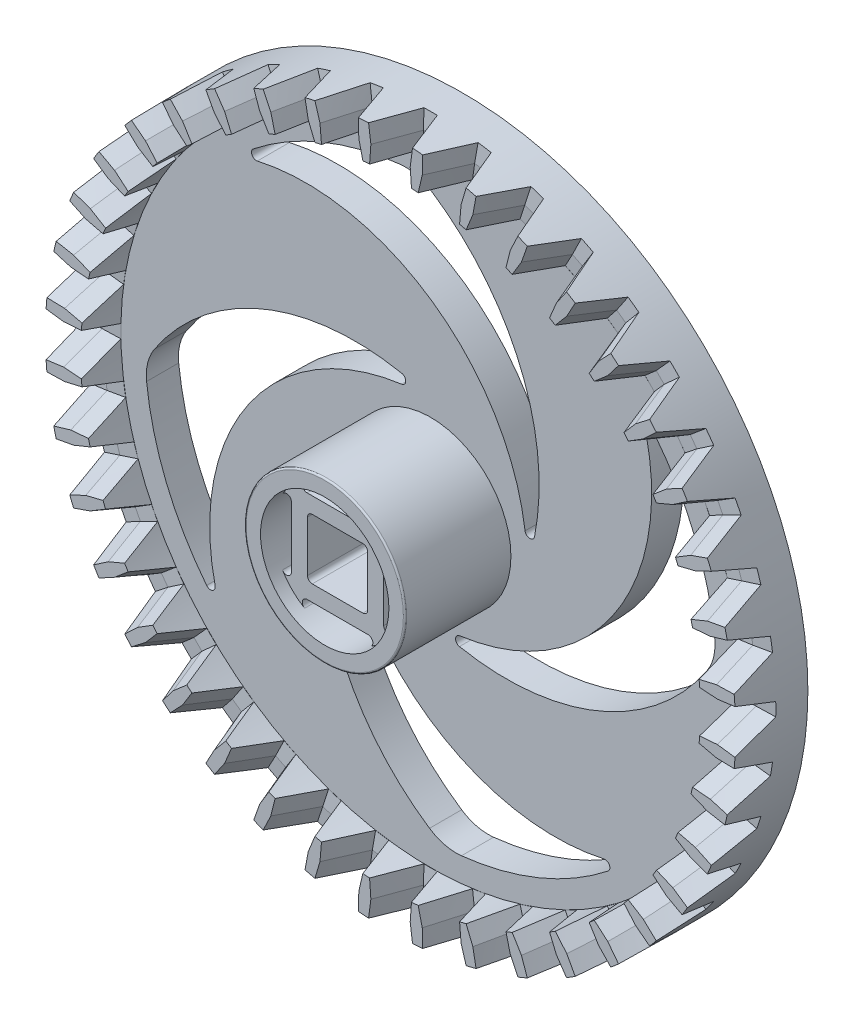
from build123d import *

# Parameters (mm, degrees)
SKETCH1_R               = 21.5
BOSS_EXTRUDE1_DEPTH     = 3.4
CUT_EXTRUDE2_DEPTH      = 31.595097647
CUT_EXTRUDE2_DEPTH_BACK = 31.595097647
SKETCH2_W               = 3.75
SKETCH2_H               = 3.75
SKETCH4_R               = 21.5
SKETCH4_R_2             = 19.3
BOSS_EXTRUDE2_DEPTH     = 2.5
CIRPATTERN1_COUNT       = 40
SKETCH9_R               = 5
SKETCH9_W               = 3.75
SKETCH9_H               = 3.75
BOSS_EXTRUDE3_DEPTH     = 6.6
SKETCH10_R              = 21.5
CUT_EXTRUDE3_DEPTH      = 1.4
BOSS_EXTRUDE4_START     = 1.4
SKETCH11_R              = 5
SKETCH11_R_2            = 4
BOSS_EXTRUDE4_DEPTH     = 1.4
SKETCH12_W              = 5.75
SKETCH12_H              = 5.75
SKETCH12_W_2            = 3.75
SKETCH12_H_2            = 3.75
BOSS_EXTRUDE5_DEPTH     = 0.6
CUT_EXTRUDE4_START      = -6.6
CUT_EXTRUDE4_DEPTH      = 6.6
CUT_EXTRUDE5_START      = -0.8
SKETCH14_R              = 4
CUT_EXTRUDE5_DEPTH      = 0.8
FILLET1_R               = 0.3
FILLET2_R               = 0.1
CUT_EXTRUDE6_DEPTH      = 10
CIRPATTERN2_COUNT       = 4
FILLET3_R               = 0.3
FILLET4_R               = 3


with BuildPart() as part:
    # Sketch1 → Boss-Extrude1 (new body)
    with BuildSketch(Plane.XY):
        Circle(SKETCH1_R)
    extrude(amount=BOSS_EXTRUDE1_DEPTH)

    # Sketch2 → Cut-Extrude2 (cut, two sides: drawn at the far end of the back side and taken through both)
    with BuildSketch(Plane.XY.offset(-CUT_EXTRUDE2_DEPTH_BACK)):
        Rectangle(SKETCH2_W, SKETCH2_H)
    extrude(amount=CUT_EXTRUDE2_DEPTH + CUT_EXTRUDE2_DEPTH_BACK, mode=Mode.SUBTRACT)

    # Sketch4 → Boss-Extrude2 (add)
    with BuildSketch(Plane.XY.offset(3.4)):
        Circle(SKETCH4_R)
        Circle(SKETCH4_R_2, mode=Mode.SUBTRACT)
    extrude(amount=BOSS_EXTRUDE2_DEPTH)

    # Sketch6 → Cut-Loft2 section 0
    with BuildSketch(Plane(origin=(0, 19.255829637, 0), x_dir=(1, 0, 0), z_dir=(0, 1, 0))):
        with BuildLine():
            Line((-1.305, -5.9), (1.305, -5.9))
            Line((1.305, -5.9), (0.415, -3.4))
            Line((0.415, -3.4), (-0.415, -3.4))
            Line((-0.415, -3.4), (-1.305, -5.9))
        make_face()
    # Sketch7 → Cut-Loft2 section 1
    with BuildSketch(Plane(origin=(0, 20.363186759, 0), x_dir=(1, 0, 0), z_dir=(0, 1, 0))):
        with BuildLine():
            Line((-1.225, -5.9), (1.225, -5.9))
            Line((1.225, -5.9), (0.35, -3.5))
            Line((0.35, -3.5), (-0.35, -3.5))
            Line((-0.35, -3.5), (-1.225, -5.9))
        make_face()
    cut_loft2 = loft(mode=Mode.SUBTRACT)

    # Sketch7<2> → Cut-Loft4 section 0
    with BuildSketch(Plane(origin=(0, 20.363186759, 0), x_dir=(1, 0, 0), z_dir=(0, 1, 0))):
        with BuildLine():
            Line((-1.225, -5.9), (1.225, -5.9))
            Line((1.225, -5.9), (0.35, -3.5))
            Line((0.35, -3.5), (-0.35, -3.5))
            Line((-0.35, -3.5), (-1.225, -5.9))
        make_face()
    # Sketch8 → Cut-Loft4 section 1
    with BuildSketch(Plane(origin=(0, 21.5, 0), x_dir=(1, 0, 0), z_dir=(0, 1, 0))):
        with BuildLine():
            Line((-1.375, -5.9), (1.375, -5.9))
            Line((1.375, -5.9), (0.415, -3.4))
            Line((0.415, -3.4), (-0.415, -3.4))
            Line((-0.415, -3.4), (-1.375, -5.9))
        make_face()
    cut_loft4 = loft(mode=Mode.SUBTRACT)

    # CirPattern1: Cut-Loft2, Cut-Loft4 ×40 about axis
    cirpattern1_axis = Axis((0, 0, 0), (0, 0, 1))
    add([cut_loft2.rotate(cirpattern1_axis, i * 360 / CIRPATTERN1_COUNT) for i in range(1, CIRPATTERN1_COUNT)], mode=Mode.SUBTRACT)
    add([cut_loft4.rotate(cirpattern1_axis, i * 360 / CIRPATTERN1_COUNT) for i in range(1, CIRPATTERN1_COUNT)], mode=Mode.SUBTRACT)

    # Sketch9 → Boss-Extrude3 (add)
    with BuildSketch(Plane.XY.offset(3.4)):
        Circle(SKETCH9_R)
        Rectangle(SKETCH9_W, SKETCH9_H, mode=Mode.SUBTRACT)
    extrude(amount=BOSS_EXTRUDE3_DEPTH)

    # Sketch10 → Cut-Extrude3 (cut)
    with BuildSketch(Plane(origin=(0, 0, 0), x_dir=(-1, 0, 0), z_dir=(0, 0, -1))):
        with Locations(Location((0, 0, 0), (0, 0, 1.10540069))):
            Circle(SKETCH10_R)
    extrude(amount=-CUT_EXTRUDE3_DEPTH, mode=Mode.SUBTRACT)

    # Sketch11 → Boss-Extrude4 (add)
    with BuildSketch(Plane(origin=(0, 0, 1.4), x_dir=(-1, 0, 0), z_dir=(0, 0, -1)).offset(BOSS_EXTRUDE4_START)):
        with Locations(Location((0, 0, 0), (0, 0, 180))):
            Circle(SKETCH11_R)
        with Locations(Location((0, 0, 0), (0, 0, 180))):
            Circle(SKETCH11_R_2, mode=Mode.SUBTRACT)
    extrude(amount=-BOSS_EXTRUDE4_DEPTH)

    # Sketch12 → Boss-Extrude5 (add)
    with BuildSketch(Plane(origin=(0, 0, 1.4), x_dir=(-1, 0, 0), z_dir=(0, 0, -1))):
        Rectangle(SKETCH12_W, SKETCH12_H)
        Rectangle(SKETCH12_W_2, SKETCH12_H_2, mode=Mode.SUBTRACT)
    extrude(amount=BOSS_EXTRUDE5_DEPTH)

    # Sketch13 → Cut-Extrude4 (cut)
    with BuildSketch(Plane.XY.offset(10).offset(CUT_EXTRUDE4_START)):
        with BuildLine():
            Line((-2.781074433, 2.875), (2.781074433, 2.875))
            ThreePointArc((2.781074433, 2.875), (0, 4), (-2.781074433, 2.875))
        make_face()
        with BuildLine():
            Line((-2.875, -2.781074433), (-2.875, 2.781074433))
            ThreePointArc((-2.875, 2.781074433), (-4, 0), (-2.875, -2.781074433))
        make_face()
        with BuildLine():
            ThreePointArc((4, 0), (3.708099244, 1.5), (2.875, 2.781074433))
            Line((2.875, 2.781074433), (2.875, -2.781074433))
            ThreePointArc((2.875, -2.781074433), (3.708099244, -1.5), (4, 0))
        make_face()
        with BuildLine():
            ThreePointArc((-2.781074433, -2.875), (0, -4), (2.781074433, -2.875))
            Line((2.781074433, -2.875), (-2.781074433, -2.875))
        make_face()
    extrude(amount=CUT_EXTRUDE4_DEPTH, mode=Mode.SUBTRACT)

    # Sketch14 → Cut-Extrude5 (cut)
    with BuildSketch(Plane.XY.offset(10).offset(CUT_EXTRUDE5_START)):
        Circle(SKETCH14_R)
    extrude(amount=CUT_EXTRUDE5_DEPTH, mode=Mode.SUBTRACT)

    # Fillet1
    # the kernel refuses this fillet: 0.3 mm, written as the material it adds along each edge
    with BuildSketch(Plane(origin=(1.875, 1.875, 0.8), x_dir=(-1, 0, 0), z_dir=(0, 0, 1)), Plane(origin=(-1.875, 1.875, 0.8), x_dir=(0, -1, 0), z_dir=(0, 0, 1))) as fillet1_piece_1:
        with BuildLine():
            CenterArc((FILLET1_R, FILLET1_R), FILLET1_R, 180, 90)
            Line((0, FILLET1_R), (0, 0))
            Line((0, 0), (FILLET1_R, 0))
        make_face()
    extrude(amount=8.4)
    with BuildSketch(Plane(origin=(-1.875, -1.875, 0.8), x_dir=(0, 1, 0), z_dir=(0, 0, 1)), Plane(origin=(1.875, -1.875, 9.2), x_dir=(0, 1, 0), z_dir=(0, 0, -1))) as fillet1_piece_2:
        with BuildLine():
            CenterArc((FILLET1_R, -FILLET1_R), FILLET1_R, 90, 90)
            Line((0, -FILLET1_R), (0, 0))
            Line((0, 0), (FILLET1_R, 0))
        make_face()
    extrude(amount=8.4)
    with BuildSketch(Plane(origin=(2.781074433, -2.875, 3.69067148), x_dir=(-1, 0, 0), z_dir=(0, 0, -1)), Plane(origin=(-2.875, -2.781074433, 3.69067148), x_dir=(0, 1, 0), z_dir=(0, 0, -1)), Plane(origin=(-2.781074433, 2.875, 3.69067148), x_dir=(1, 0, 0), z_dir=(0, 0, -1)), Plane(origin=(2.875, 2.781074433, 3.69067148), x_dir=(0, -1, 0), z_dir=(0, 0, -1))) as fillet1_piece_3:
        with BuildLine():
            CenterArc((0.881238913, -0.3), FILLET1_R, 90, 149.104820427)
            ThreePointArc((0.727198196, -0.557432432), (0.347585225, -0.299607106), (0, 0))
            Line((0, 0), (0.881238913, 0))
        make_face()
    extrude(amount=2.89067148)
    with BuildSketch(Plane(origin=(2.875, -2.781074433, 3.69067148), x_dir=(0, 1, 0), z_dir=(0, 0, -1)), Plane(origin=(-2.781074433, -2.875, 3.69067148), x_dir=(1, 0, 0), z_dir=(0, 0, -1)), Plane(origin=(-2.875, 2.781074433, 3.69067148), x_dir=(0, -1, 0), z_dir=(0, 0, -1)), Plane(origin=(2.781074433, 2.875, 3.69067148), x_dir=(-1, 0, 0), z_dir=(0, 0, -1))) as fillet1_piece_4:
        with BuildLine():
            CenterArc((0.881238913, 0.3), FILLET1_R, 120.895179573, 149.104820427)
            ThreePointArc((0.727198196, 0.557432432), (0.347585225, 0.299607106), (0, 0))
            Line((0, 0), (0.881238913, 0))
        make_face()
    extrude(amount=2.89067148)
    with BuildSketch(Plane(origin=(2.781074433, 2.875, 1.10932852), x_dir=(-0.7936517764559898, 0.6083723019075175, 0), z_dir=(0, 0, 1)), Plane(origin=(-2.875, 2.781074433, 1.10932852), x_dir=(-0.6083723019075178, -0.7936517764559895, 0), z_dir=(0, 0, 1)), Plane(origin=(2.875, -2.781074433, 1.10932852), x_dir=(0.6083723019075181, 0.7936517764559893, 0), z_dir=(0, 0, 1))) as fillet1_piece_5:
        with BuildLine():
            CenterArc((0.88190852, 0.298025813), FILLET1_R, 127.471902624, 149.104820426)
            Line((0.699396829, 0.536121346), (0, 0))
            ThreePointArc((0, 0), (0.458134296, -0.026322488), (0.916268592, 0))
        make_face()
    extrude(amount=8.09067148)
    with BuildSketch(Plane(origin=(-2.781074433, 2.875, 1.10932852), x_dir=(0.7936517764559894, 0.608372301907518, 0), z_dir=(0, 0, 1)), Plane(origin=(-2.875, -2.781074433, 1.10932852), x_dir=(-0.6083723019075185, 0.793651776455989, 0), z_dir=(0, 0, 1)), Plane(origin=(2.875, 2.781074433, 1.10932852), x_dir=(0.6083723019075178, -0.7936517764559896, 0), z_dir=(0, 0, 1))) as fillet1_piece_6:
        with BuildLine():
            CenterArc((0.88190852, -0.298025813), FILLET1_R, 83.423276949, 149.104820426)
            Line((0.699396829, -0.536121346), (0, 0))
            ThreePointArc((0, 0), (0.458134296, 0.026322488), (0.916268592, 0))
        make_face()
    extrude(amount=8.09067148)
    with BuildSketch(Plane(origin=(-2.781074433, -2.875, 1.10932852), x_dir=(1, 0, 0), z_dir=(0, 0, 1))) as fillet1_piece_7:
        with BuildLine():
            CenterArc((0.881238913, -0.3), FILLET1_R, 90, 149.104820427)
            ThreePointArc((0.727198196, -0.557432432), (0.347585225, -0.299607106), (0, 0))
            Line((0, 0), (0.881238913, 0))
        make_face()
    extrude(amount=8.09067148)
    with BuildSketch(Plane(origin=(2.781074433, -2.875, 1.10932852), x_dir=(-1, 0, 0), z_dir=(0, 0, 1))) as fillet1_piece_8:
        with BuildLine():
            CenterArc((0.881238913, 0.3), FILLET1_R, 120.895179573, 149.104820427)
            ThreePointArc((0.727198196, 0.557432432), (0.347585225, 0.299607106), (0, 0))
            Line((0, 0), (0.881238913, 0))
        make_face()
    extrude(amount=8.09067148)

    # Fillet2
    fillet2_edges = [part.edges().sort_by_distance(p)[0] for p in [
        (-5, 0, 10),
        (-5, 0, 0),
    ]]
    fillet(fillet2_edges, radius=FILLET2_R)

    # Sketch17 → Cut-Extrude6 (cut)
    with BuildSketch(Plane(origin=(0, 0, 1.4), x_dir=(-1, 0, 0), z_dir=(0, 0, -1))):
        with BuildLine():
            ThreePointArc((-6, 0), (-0.298648947, 11.156072777), (12.08265327, 13.070940668))
            ThreePointArc((12.08265327, 13.070940668), (6.883455117, 16.415177296), (0.854010688, 17.779501279))
            ThreePointArc((0.854010688, 17.779501279), (-5.752550524, 10.115471742), (-6, 0))
        make_face()
    cut_extrude6 = extrude(amount=-CUT_EXTRUDE6_DEPTH, mode=Mode.SUBTRACT)

    # CirPattern2: Cut-Extrude6 ×4 about axis
    cirpattern2_axis = Axis((0, 0, 0), (0, 0, 1))
    for i in range(1, CIRPATTERN2_COUNT):
        add(cut_extrude6.rotate(cirpattern2_axis, i * 360 / CIRPATTERN2_COUNT), mode=Mode.SUBTRACT)

    # Fillet3
    fillet3_edges = [part.edges().sort_by_distance(p)[0] for p in [
        (6, 0, 2.4),
        (-12.08265327, 13.070940668, 2.4),
        (-6, 0, 2.4),
        (12.08265327, -13.070940668, 2.4),
        (0, 6, 2.4),
        (-13.070940668, -12.08265327, 2.4),
        (0, -6, 2.4),
        (13.070940668, 12.08265327, 2.4),
    ]]
    fillet(fillet3_edges, radius=FILLET3_R)

    # Fillet4
    fillet4_edges = [part.edges().sort_by_distance(p)[0] for p in [
        (-0.854010688, 17.779501279, 2.4),
        (0.854010688, -17.779501279, 2.4),
        (-17.779501279, -0.854010688, 2.4),
        (17.779501279, 0.854010688, 2.4),
    ]]
    fillet(fillet4_edges, radius=FILLET4_R)


solid = part.part
